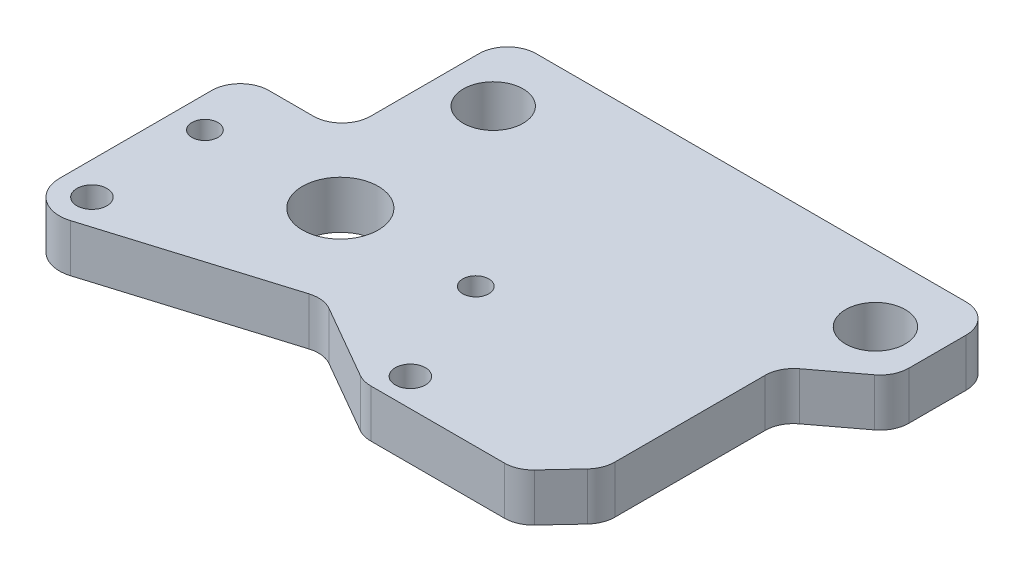
from build123d import *

# Parameters (mm, degrees)
SKETCH4_R           = 2
SKETCH4_R_2         = 1.7272
SKETCH4_R_3         = 5.04
SKETCH4_R_4         = 3.96875
BOSS_EXTRUDE2_DEPTH = 6.35


with BuildPart() as part:
    # Sketch4 → Boss-Extrude2 (new body)
    with BuildSketch(Plane(origin=(0, 0, 0), x_dir=(1, 0, 0), z_dir=(0, 1, 0))):
        with BuildLine():
            Line((22.483900583, -18.4375), (40.257702493, -18.4375))
            ThreePointArc((40.257702493, -18.4375), (41.776936446, -18.121498883), (43.044160097, -17.225913752))
            Line((43.044160097, -17.225913752), (46.444939319, -13.579024524))
            ThreePointArc((46.444939319, -13.579024524), (47.203372649, -12.376980446), (47.468481715, -10.980610773))
            Line((47.468481715, -10.980610773), (47.468481715, 8.985116992))
            ThreePointArc((47.468481715, 8.985116992), (47.868781798, 10.685130659), (48.985566477, 12.027918285))
            Line((48.985566477, 12.027918285), (54.680415238, 16.319294633))
            ThreePointArc((54.680415238, 16.319294633), (55.797199918, 17.662082259), (56.1975, 19.362095927))
            Line((56.1975, 19.362095927), (56.1975, 26.9875))
            ThreePointArc((56.1975, 26.9875), (55.081576836, 29.681576836), (52.3875, 30.7975))
            Line((52.3875, 30.7975), (-4.7625, 30.7975))
            ThreePointArc((-4.7625, 30.7975), (-7.456576836, 29.681576836), (-8.5725, 26.9875))
            Line((-8.5725, 26.9875), (-8.5725, 12.607500122))
            ThreePointArc((-8.5725, 12.607500122), (-9.688423164, 9.913423286), (-12.3825, 8.797500122))
            Line((-12.3825, 8.797500122), (-18.288, 8.797500122))
            ThreePointArc((-18.288, 8.797500122), (-20.982076836, 7.681576958), (-22.098, 4.987500122))
            Line((-22.098, 4.987500122), (-22.098, -15.24))
            ThreePointArc((-22.098, -15.24), (-20.348558836, -18.710969534), (-16.517810325, -19.369406885))
            Line((-16.517810325, -19.369406885), (7.765559219, -11.946980575))
            ThreePointArc((7.765559219, -11.946980575), (9.307944036, -11.804768953), (10.779476649, -12.288263354))
            Line((10.779476649, -12.288263354), (20.583679925, -17.929811531))
            ThreePointArc((20.583679925, -17.929811531), (21.500464498, -18.308390309), (22.483900583, -18.4375))
        make_face()
        with Locations((-17.78, -15.24)):
            Circle(SKETCH4_R, mode=Mode.SUBTRACT)
        with Locations((-18.000000004, 0)):
            Circle(SKETCH4_R_2, mode=Mode.SUBTRACT)
        Circle(SKETCH4_R_3, mode=Mode.SUBTRACT)
        with Locations((24.012521227, -14.703599027)):
            Circle(SKETCH4_R, mode=Mode.SUBTRACT)
        with Locations((18.000000004, 0)):
            Circle(SKETCH4_R_2, mode=Mode.SUBTRACT)
        with Locations((-1.5875, 21.9075)):
            Circle(SKETCH4_R_4, mode=Mode.SUBTRACT)
        with Locations((49.2125, 21.9075)):
            Circle(SKETCH4_R_4, mode=Mode.SUBTRACT)
    extrude(amount=-BOSS_EXTRUDE2_DEPTH)


solid = part.part
